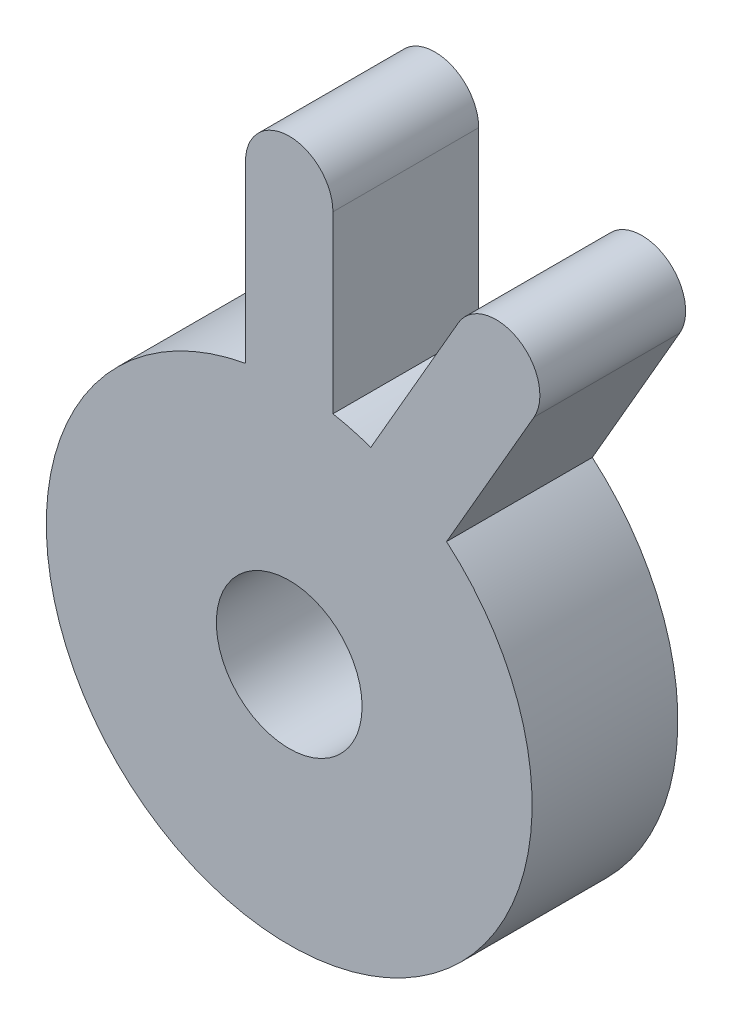
from build123d import *

# Parameters (mm, degrees)
SKETCH1_R           = 7.5
BOSS_EXTRUDE1_DEPTH = 15
SCALE2_SCALE        = 0.264705882


with BuildPart() as part:
    # Sketch1 → Boss-Extrude1 (new body)
    with BuildSketch(Plane.XY):
        with BuildLine():
            Line((-4.5, 42.591665255), (-4.5, 24.591665255))
            ThreePointArc((-4.5, 24.591665255), (-6.470476128, -24.148145657), (16.192946944, 19.047006832))
            Line((16.192946944, 19.047006832), (25.192946944, 34.6354641))
            ThreePointArc((25.192946944, 34.6354641), (23.545832627, 40.782578417), (17.39871831, 39.1354641))
            Line((17.39871831, 39.1354641), (8.39871831, 23.547006832))
            ThreePointArc((8.39871831, 23.547006832), (6.470476128, 24.148145657), (4.5, 24.591665255))
            Line((4.5, 24.591665255), (4.5, 42.591665255))
            ThreePointArc((4.5, 42.591665255), (0, 47.091665255), (-4.5, 42.591665255))
        make_face()
        Circle(SKETCH1_R, mode=Mode.SUBTRACT)
    extrude(amount=BOSS_EXTRUDE1_DEPTH)


with BuildPart() as part_1:
    # Scale2: scaled about (0, 0, 0)
    add(part.part.scale(SCALE2_SCALE))


solid = part_1.part
